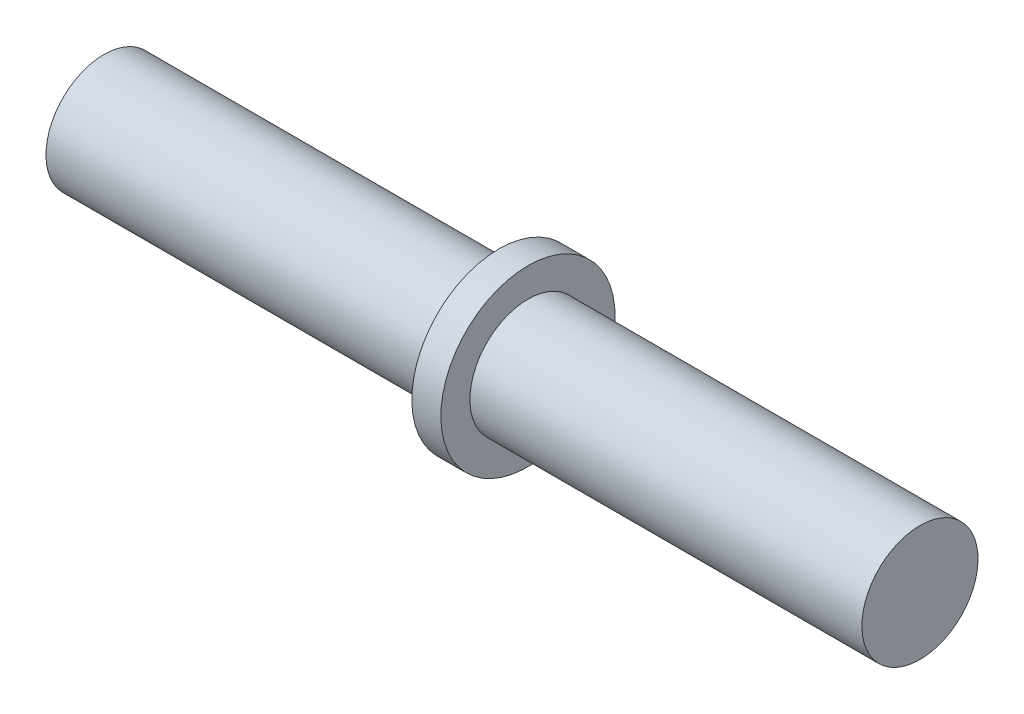
from build123d import *


with BuildPart() as part:
    # Sketch2 → Revolve1 (revolve)
    with BuildSketch(Plane.XY):
        Polygon((-28.1, 4), (-0.9, 4), (-0.9, 6), (1.1, 6), (1.1, 4), (28.1, 4), (28.1, 0), (-28.1, 0), align=None)
    revolve(axis=Axis((28.1, 0, 0), (-1, 0, 0)))


solid = part.part
